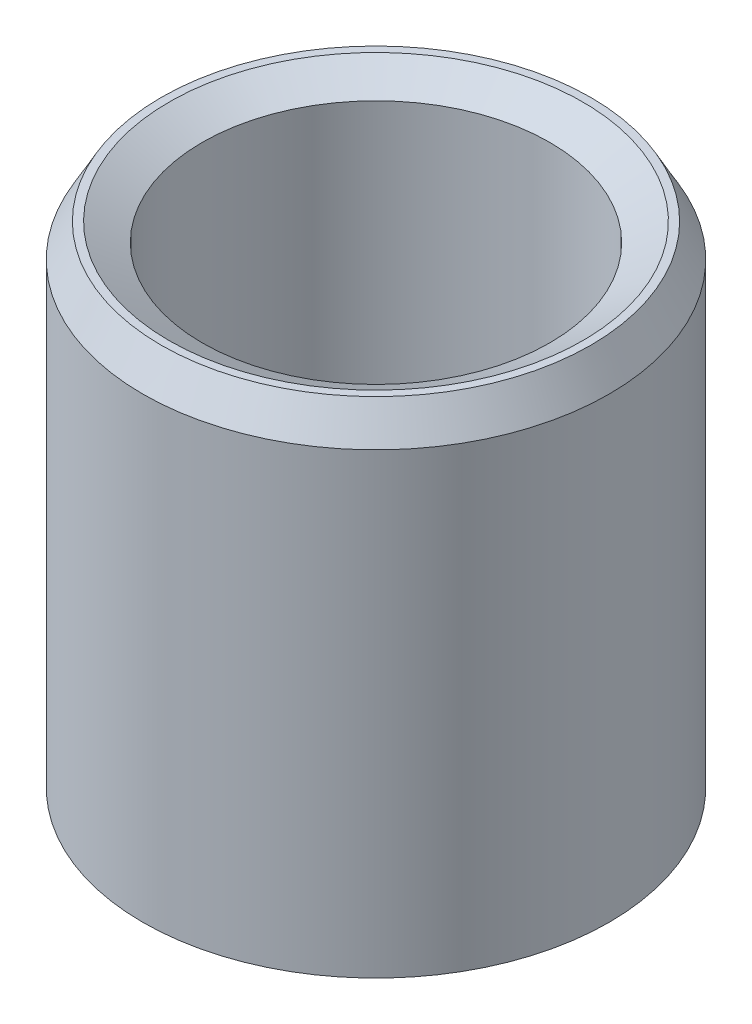
from build123d import *
from OCP.BRepFilletAPI import BRepFilletAPI_MakeChamfer

# Parameters (mm, degrees)
SKETCH1_R           = 22.5
BOSS_EXTRUDE1_DEPTH = 49.115994979
SKETCH2_R           = 16.764222453
CUT_EXTRUDE1_DEPTH  = 59.522482542
CHAMFER1_SIZE       = 3.18877021
CHAMFER1_SIZE2      = 1.780928006


with BuildPart() as part:
    # Sketch1 → Boss-Extrude1 (new body)
    with BuildSketch(Plane(origin=(0, 0, 0), x_dir=(1, 0, 0), z_dir=(0, 1, 0))):
        Circle(SKETCH1_R)
    extrude(amount=BOSS_EXTRUDE1_DEPTH)

    # Sketch2 → Cut-Extrude1 (cut, through all)
    with BuildSketch(Plane(origin=(0, 0, 0), x_dir=(1, 0, 0), z_dir=(0, 1, 0))):
        Circle(SKETCH2_R)
    extrude(amount=CUT_EXTRUDE1_DEPTH, mode=Mode.SUBTRACT)

    # Chamfer1: one chamfer whose edges measure the first distance from different faces: ONE call of the kernel's chamfer builder (chamfer() names one face for all edges)
    chamfer1_edges_1 = [part.edges().sort_by_distance(p)[0] for p in [
        (-16.764222453, 49.115994979, 0),
    ]]
    chamfer1_side_1 = [part.faces().sort_by_distance(p)[0] for p in [
        (-21.863603897, 49.115994979, 0),
    ]]
    chamfer1_edges_2 = [part.edges().sort_by_distance(p)[0] for p in [
        (-16.764222453, 0, 0),
    ]]
    chamfer1_side_2 = [part.faces().sort_by_distance(p)[0] for p in [
        (-16.764222453, 24.55799749, 0),
    ]]
    chamfer1_edges_3 = [part.edges().sort_by_distance(p)[0] for p in [
        (-22.5, 0, 0),
    ]]
    chamfer1_side_3 = [part.faces().sort_by_distance(p)[0] for p in [
        (-21.863603897, 0, 0),
    ]]
    chamfer1_edges_4 = [part.edges().sort_by_distance(p)[0] for p in [
        (-22.5, 49.115994979, 0),
    ]]
    chamfer1_side_4 = [part.faces().sort_by_distance(p)[0] for p in [
        (-22.5, 24.55799749, 0),
    ]]
    chamfer1 = BRepFilletAPI_MakeChamfer(part.part.solid().wrapped)
    for e in chamfer1_edges_1:
        chamfer1.Add(CHAMFER1_SIZE, CHAMFER1_SIZE2, e.wrapped, chamfer1_side_1[0].wrapped)  # the first distance lies on this face
    for e in chamfer1_edges_2:
        chamfer1.Add(CHAMFER1_SIZE, CHAMFER1_SIZE2, e.wrapped, chamfer1_side_2[0].wrapped)  # the first distance lies on this face
    for e in chamfer1_edges_3:
        chamfer1.Add(CHAMFER1_SIZE, CHAMFER1_SIZE2, e.wrapped, chamfer1_side_3[0].wrapped)  # the first distance lies on this face
    for e in chamfer1_edges_4:
        chamfer1.Add(CHAMFER1_SIZE, CHAMFER1_SIZE2, e.wrapped, chamfer1_side_4[0].wrapped)  # the first distance lies on this face
    add(Compound.cast(chamfer1.Shape()), mode=Mode.REPLACE)


solid = part.part
